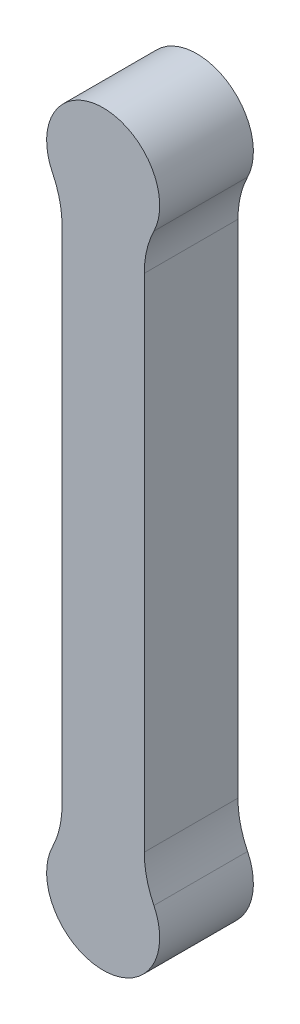
from build123d import *

# Parameters (mm, degrees)
BOSS_EXTRU_1_DEPTH = 10
CONG_1_R           = 10


with BuildPart() as part:
    # Esquisse1 → Boss.-Extru.1 (new body)
    with BuildSketch(Plane.XY):
        with BuildLine():
            Line((-4.387325419, 29.691836593), (-4.387325419, -29.691836593))
            ThreePointArc((-4.387325419, -29.691836593), (0, -39.871589085), (4.387325419, -29.691836593))
            Line((4.387325419, -29.691836593), (4.387325419, 29.691836593))
            ThreePointArc((4.387325419, 29.691836593), (0, 39.871589085), (-4.387325419, 29.691836593))
        make_face()
    extrude(amount=BOSS_EXTRU_1_DEPTH)

    # Congé1
    cong_1_edges = [part.edges().sort_by_distance(p)[0] for p in [
        (-4.387325419, -29.691836593, 5),
        (-4.387325419, 29.691836593, 5),
        (4.387325419, -29.691836593, 5),
        (4.387325419, 29.691836593, 5),
    ]]
    fillet(cong_1_edges, radius=CONG_1_R)


solid = part.part
